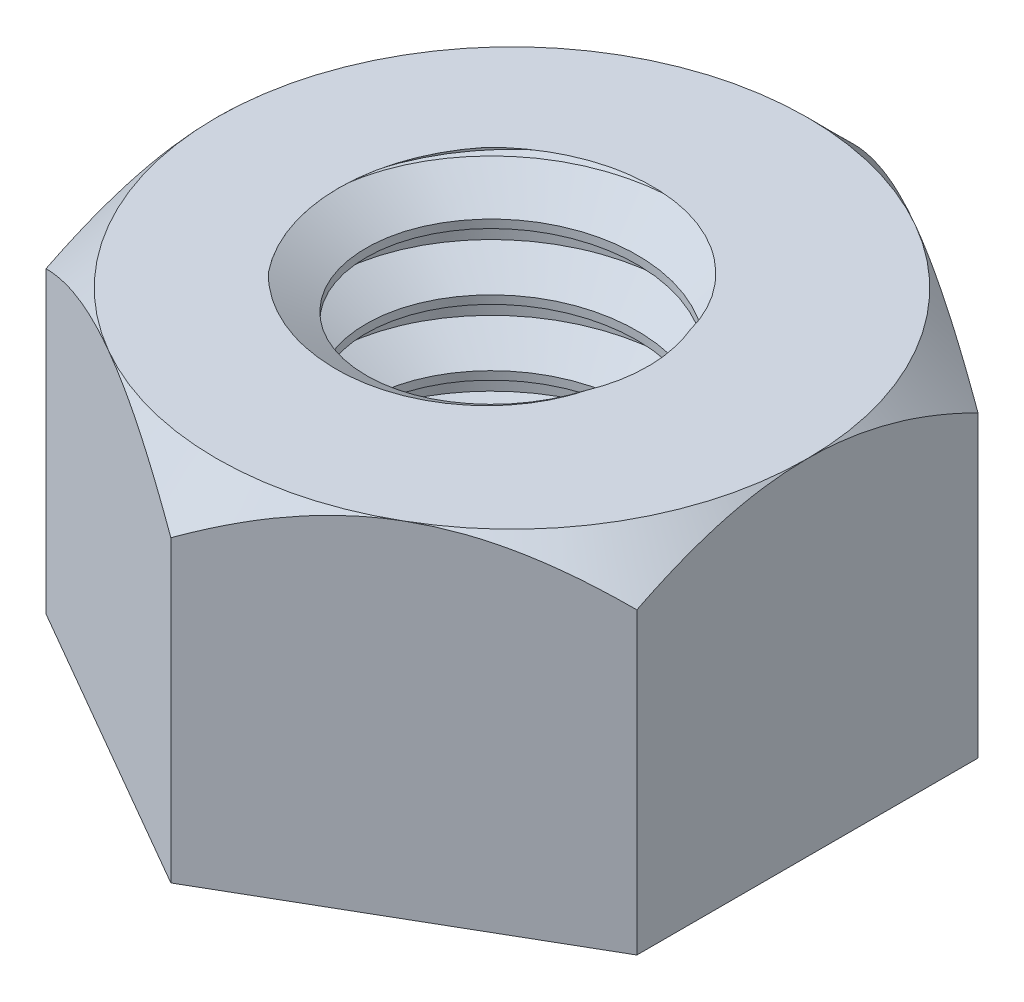
from build123d import *

# Parameters (mm, degrees)
EXTRUDE1_DEPTH     = 8.334375
SKETCH6_2_R        = 4.191
CUT_EXTRUDE1_DEPTH = 14.730957339
SWEEP3_PITCH       = 1.5875
CUT_EXTRUDE2_DEPTH = 2.54
SKETCH12_R         = 5.103852455
CUT_EXTRUDE3_DEPTH = 14.730957512


with BuildPart() as part:
    # Sketch1 → Extrude1 (new body)
    with BuildSketch(Plane(origin=(0, 0, 0), x_dir=(1, 0, 0), z_dir=(0, 1, 0))):
        Polygon((0, 8.248891971), (-7.14375, 4.124445986), (-7.14375, -4.124445986), (0, -8.248891971), (7.14375, -4.124445986), (7.14375, 4.124445986), align=None)
    extrude(amount=EXTRUDE1_DEPTH)

    # Sketch3 → Cut-Revolve2 (revolve, cut)
    with BuildSketch(Plane(origin=(0, 0, 0), x_dir=(0, 0, -1), z_dir=(1, 0, 0))):
        Polygon((7.14375, 8.334375), (8.248891971, 7.229233029), (8.248891971, 8.334375), align=None)
    revolve(axis=Axis((0, 0.541995889, 0), (0, -1, 0)), mode=Mode.SUBTRACT)

    # Sketch2 → Cut-Revolve1 (revolve, cut)
    with BuildSketch(Plane.XY, mode=Mode.PRIVATE) as cut_revolve1_sk:
        Polygon((0, 8.334375), (4.18966028, 8.334375), (4.7625, 8.003645833), (4.7625, 7.871354167), (4.18966028, 7.540625), (4.18966028, 7.276041667), (0, 7.276041667), align=None)
    revolve(cut_revolve1_sk.sketch.rotate(Axis((0, 1.663578541, 0), (0, -1, 0)), 90), axis=Axis((0, 1.663578541, 0), (0, -1, 0)), mode=Mode.SUBTRACT)

    # Sketch6<2> → Cut-Extrude1 (cut, through all)
    with BuildSketch(Plane(origin=(0, 0, 0), x_dir=(1, 0, 0), z_dir=(0, 1, 0))):
        with Locations(Location((0, 0, 0), (0, 0, 270))):
            Circle(SKETCH6_2_R)
    extrude(amount=CUT_EXTRUDE1_DEPTH, mode=Mode.SUBTRACT)

    # Sweep3: arcs per turn and ends read off the stored shape
    # Sweep3: the profile of Sketch11 screwed along a right-hand helix through 8 turns, 8 arcs to a turn; built about Z, then put on its axis
    sweep3_z = Axis((0, 0, 0), (0, 0, 1))
    sweep3_corners = [(3.286660548, 0, -1.09140625), (3.286660548, 0, -1.28984375), (4.317772045, 0, -1.88515625), (4.317772045, 0, -0.49609375)]
    with BuildLine(mode=Mode.PRIVATE) as sweep3_profile:
        Line(sweep3_corners[0], sweep3_corners[1])
        Line(sweep3_corners[1], sweep3_corners[2])
        Line(sweep3_corners[2], sweep3_corners[3])
        Line(sweep3_corners[3], sweep3_corners[0])
    sweep3_cap = Face(sweep3_profile.wire())
    sweep3_turn_angles = [0, 22.5, 45, 67.5, 90, 112.5, 135, 157.5, 180, 202.5, 225, 247.5, 270, 292.5, 315, 337.5, 360]
    sweep3_turn_weights = [1, 0.9238795325112867, 1, 0.9238795325112867, 1, 0.9238795325112867, 1, 0.9238795325112867, 1, 0.9238795325112867, 1, 0.9238795325112867, 1, 0.9238795325112867, 1, 0.9238795325112867, 1]
    sweep3_turn_rails = [Edge.make_bspline([Vector(p[0], p[1], 0).rotate(sweep3_z, sweep3_turn_angles[k]) / sweep3_turn_weights[k] + Vector(0, 0, p[2] + SWEEP3_PITCH * sweep3_turn_angles[k] / 360) for k in range(17)], [0, 0, 0, 1, 1, 2, 2, 3, 3, 4, 4, 5, 5, 6, 6, 7, 7, 8, 8, 8], 2, sweep3_turn_weights) for p in sweep3_corners]
    sweep3_turn_sides = [Face.make_surface_from_curves(sweep3_turn_rails[p[0]], sweep3_turn_rails[p[1]]) for p in [(0, 1), (1, 2), (2, 3), (3, 0)]]
    sweep3 = Plane(origin=(0, 0, 0), x_dir=(1, 0, 0), z_dir=(0, 1, 0)) * Solid(Shell([*[p.moved(Location((0, 0, SWEEP3_PITCH * i))) for i in range(8) for p in sweep3_turn_sides], sweep3_cap, sweep3_cap.rotate(sweep3_z, 2880).moved(Location((0, 0, SWEEP3_PITCH * 2880 / 360)))]))
    add(sweep3)

    # Sketch1<2> → Cut-Extrude2 (cut)
    with BuildSketch(Plane(origin=(0, 0, 0), x_dir=(1, 0, 0), z_dir=(0, 1, 0))):
        Polygon((0, 8.248891971), (-7.14375, 4.124445986), (-7.14375, -4.124445986), (0, -8.248891971), (7.14375, -4.124445986), (7.14375, 4.124445986), align=None)
    extrude(amount=-CUT_EXTRUDE2_DEPTH, mode=Mode.SUBTRACT)

    # Sketch12 → Cut-Extrude3 (cut, through all)
    with BuildSketch(Plane(origin=(0, 8.334375, 0), x_dir=(1, 0, 0), z_dir=(0, 1, 0))):
        Circle(SKETCH12_R)
    extrude(amount=CUT_EXTRUDE3_DEPTH, mode=Mode.SUBTRACT)


solid = part.part
